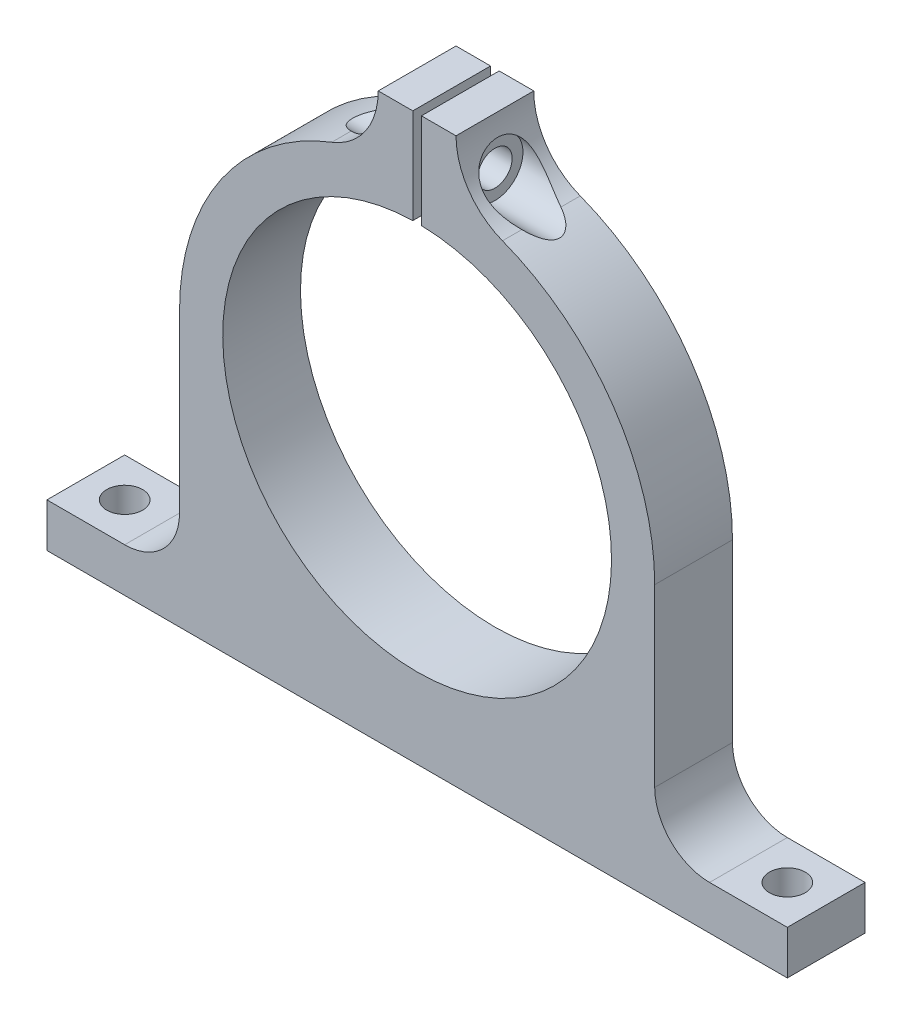
from build123d import *

# Parameters (mm, degrees)
BOSS_EXTRUDE1_DEPTH     = 18
CUT_EXTRUDE4_DEPTH      = 112.040037824
CUT_EXTRUDE4_DEPTH_BACK = 112.040037824
SKETCH7_R               = 4
SKETCH8_R               = 6.5
CUT_EXTRUDE5_DEPTH      = 18
CUT_EXTRUDE6_START      = -18
SKETCH10_R              = 6.5
CUT_EXTRUDE6_DEPTH      = 18
SKETCH11_R              = 4.15
CUT_EXTRUDE7_DEPTH      = 149.829451479


with BuildPart() as part:
    # Sketch1 → Boss-Extrude1 (new body)
    with BuildSketch(Plane.XY):
        with BuildLine():
            Line((85.7, -53.34), (85.7, -63.5))
            Line((85.7, -63.5), (-85.7, -63.5))
            Line((-85.7, -63.5), (-85.7, -53.34))
            Line((-85.7, -53.34), (-67.7, -53.34))
            ThreePointArc((-67.7, -53.34), (-58.719743879, -49.620256121), (-55, -40.64))
            Line((-55, -40.64), (-55, 0))
            ThreePointArc((-55, 0), (-45.342042661, 31.130357648), (-19.76003028, 51.327781983))
            ThreePointArc((-19.76003028, 51.327781983), (-11.948921757, 57.494782102), (-9, 67))
            Line((-9, 67), (-1, 67))
            Line((-1, 67), (-1, 44.988887517))
            ThreePointArc((-1, 44.988887517), (0, -45), (1, 44.988887517))
            Line((1, 44.988887517), (1, 67))
            Line((1, 67), (9, 67))
            ThreePointArc((9, 67), (11.948921757, 57.494782102), (19.76003028, 51.327781983))
            ThreePointArc((19.76003028, 51.327781983), (45.342042661, 31.130357648), (55, 0))
            Line((55, 0), (55, -40.64))
            ThreePointArc((55, -40.64), (58.719743879, -49.620256121), (67.7, -53.34))
            Line((67.7, -53.34), (85.7, -53.34))
        make_face()
    extrude(amount=BOSS_EXTRUDE1_DEPTH)

    # Sketch7 → Cut-Extrude4 (cut, two sides: drawn at the far end of the back side and taken through both)
    with BuildSketch(Plane.ZY.offset(-1).offset(-CUT_EXTRUDE4_DEPTH_BACK)):
        with Locations((9, 55.994443758)):
            Circle(SKETCH7_R)
    extrude(amount=CUT_EXTRUDE4_DEPTH + CUT_EXTRUDE4_DEPTH_BACK, mode=Mode.SUBTRACT)

    # Sketch8 → Cut-Extrude5 (cut)
    with BuildSketch(Plane(origin=(-9, 0, 0), x_dir=(0, 0, -1), z_dir=(1, 0, 0))):
        with Locations((-9, 55.994443758)):
            Circle(SKETCH8_R)
    extrude(amount=-CUT_EXTRUDE5_DEPTH, mode=Mode.SUBTRACT)

    # Sketch10 → Cut-Extrude6 (cut)
    with BuildSketch(Plane.ZY.offset(-9).offset(CUT_EXTRUDE6_START)):
        with Locations((9, 55.994443758)):
            Circle(SKETCH10_R)
    extrude(amount=CUT_EXTRUDE6_DEPTH, mode=Mode.SUBTRACT)

    # Sketch11 → Cut-Extrude7 (cut, through all)
    with BuildSketch(Plane(origin=(0, -53.34, 0), x_dir=(1, 0, 0), z_dir=(0, 1, 0))):
        with Locations((-76.7, -9)):
            Circle(SKETCH11_R)
        with Locations((76.7, -9)):
            Circle(SKETCH11_R)
    extrude(amount=-CUT_EXTRUDE7_DEPTH, mode=Mode.SUBTRACT)


solid = part.part
